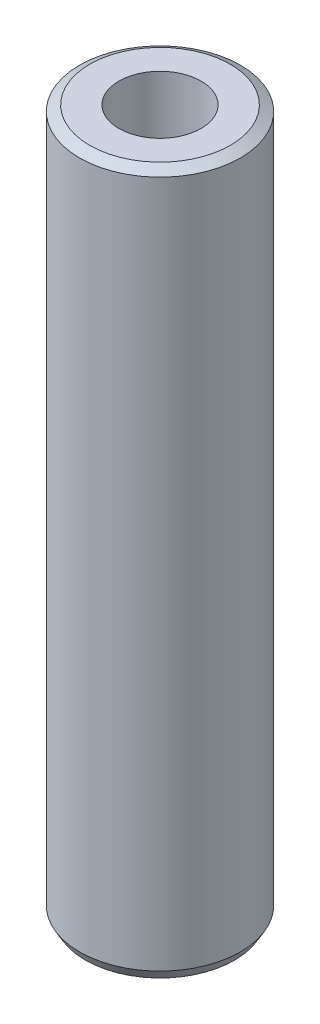
from build123d import *
from OCP.BRepFilletAPI import BRepFilletAPI_MakeChamfer

# Parameters (mm, degrees)
SKETCH1_R           = 37.5
BOSS_EXTRUDE1_DEPTH = 328.050613929
SKETCH2_R           = 19.157340522
CUT_EXTRUDE1_DEPTH  = 333.309652732
CHAMFER1_SIZE       = 2.725780535
CHAMFER1_SIZE2      = 4.721190376


with BuildPart() as part:
    # Sketch1 → Boss-Extrude1 (new body)
    with BuildSketch(Plane(origin=(0, 0, 0), x_dir=(1, 0, 0), z_dir=(0, 1, 0))):
        Circle(SKETCH1_R)
    extrude(amount=BOSS_EXTRUDE1_DEPTH)

    # Sketch2 → Cut-Extrude1 (cut, through all)
    with BuildSketch(Plane(origin=(0, 0, 0), x_dir=(1, 0, 0), z_dir=(0, 1, 0))):
        Circle(SKETCH2_R)
    extrude(amount=CUT_EXTRUDE1_DEPTH, mode=Mode.SUBTRACT)

    # Chamfer1: one chamfer whose edges measure the first distance from different faces: ONE call of the kernel's chamfer builder (chamfer() names one face for all edges)
    chamfer1_edges_1 = [part.edges().sort_by_distance(p)[0] for p in [
        (-37.5, 328.050613929, 0),
    ]]
    chamfer1_side_1 = [part.faces().sort_by_distance(p)[0] for p in [
        (-37.5, 164.025306964, 0),
    ]]
    chamfer1_edges_2 = [part.edges().sort_by_distance(p)[0] for p in [
        (-37.5, 0, 0),
    ]]
    chamfer1_side_2 = [part.faces().sort_by_distance(p)[0] for p in [
        (-36.439339828, 0, 0),
    ]]
    chamfer1 = BRepFilletAPI_MakeChamfer(part.part.solid().wrapped)
    for e in chamfer1_edges_1:
        chamfer1.Add(CHAMFER1_SIZE, CHAMFER1_SIZE2, e.wrapped, chamfer1_side_1[0].wrapped)  # the first distance lies on this face
    for e in chamfer1_edges_2:
        chamfer1.Add(CHAMFER1_SIZE, CHAMFER1_SIZE2, e.wrapped, chamfer1_side_2[0].wrapped)  # the first distance lies on this face
    add(Compound.cast(chamfer1.Shape()), mode=Mode.REPLACE)


solid = part.part
